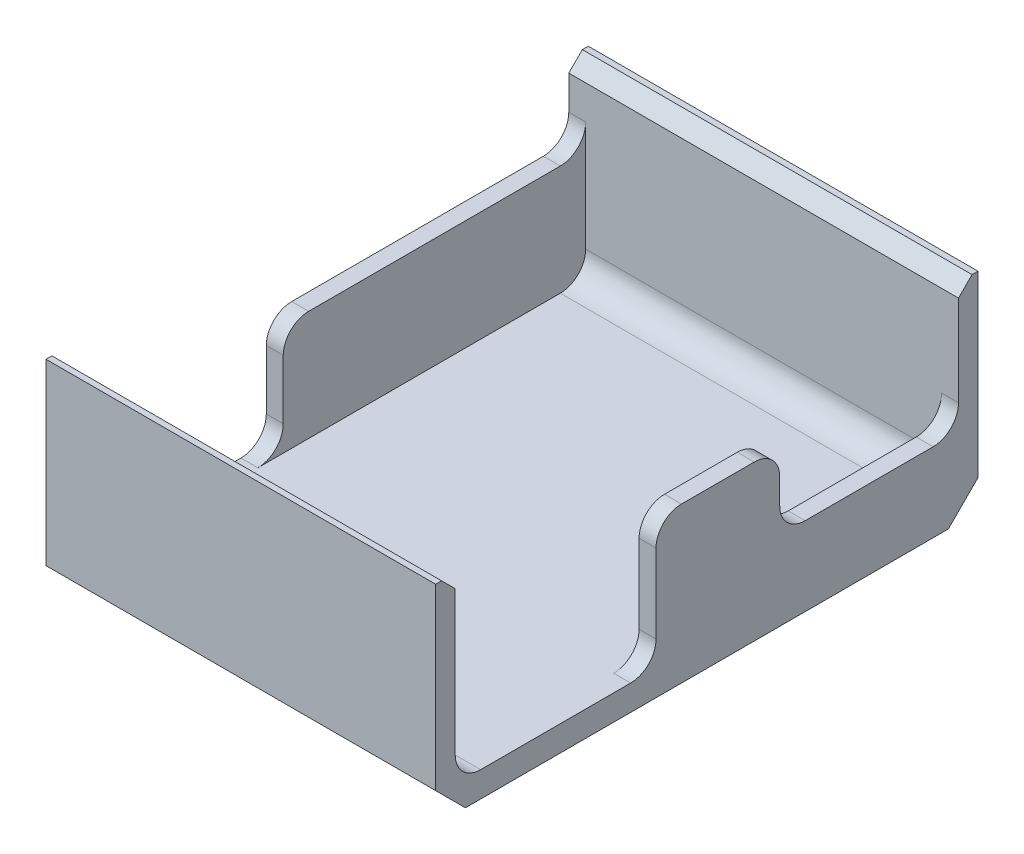
from build123d import *

# Parameters (mm, degrees)
SKETCH1_W           = 46
SKETCH1_H           = 64
BOSS_EXTRUDE1_DEPTH = 3
SKETCH2_W           = 46
SKETCH2_H           = 2.3
BOSS_EXTRUDE2_DEPTH = 22
SKETCH3_W           = 38
SKETCH3_H           = 16
BOSS_EXTRUDE3_DEPTH = 2
BOSS_EXTRUDE4_DEPTH = 2
FILLET1_R           = 3
SKETCH8_W           = 6
SKETCH8_H           = 1.076923077
BOSS_EXTRUDE5_DEPTH = 0.5
CHAMFER1_SIZE       = 2
SKETCH9_W           = 64
SKETCH9_H           = 0.4
CUT_EXTRUDE1_DEPTH  = 83.68615375
CHAMFER2_SIZE       = 3.5


with BuildPart() as part:
    # Sketch1 → Boss-Extrude1 (new body)
    with BuildSketch(Plane(origin=(0, 0, 0), x_dir=(1, 0, 0), z_dir=(0, 1, 0))):
        with Locations((23, 32)):
            Rectangle(SKETCH1_W, SKETCH1_H)
    extrude(amount=BOSS_EXTRUDE1_DEPTH)

    # Sketch2 → Boss-Extrude2 (add)
    with BuildSketch(Plane(origin=(0, 3, 0), x_dir=(1, 0, 0), z_dir=(0, 1, 0))):
        with Locations((23, 62.85)):
            Rectangle(SKETCH2_W, SKETCH2_H)
        with Locations((23, 1.15)):
            Rectangle(SKETCH2_W, SKETCH2_H)
    extrude(amount=BOSS_EXTRUDE2_DEPTH)

    # Sketch3 → Boss-Extrude3 (add)
    with BuildSketch(Plane.ZY):
        with Locations((-45, 8)):
            Rectangle(SKETCH3_W, SKETCH3_H)
    extrude(amount=-BOSS_EXTRUDE3_DEPTH)

    # Sketch5 → Boss-Extrude4 (add)
    with BuildSketch(Plane(origin=(46, 0, 0), x_dir=(0, 0, -1), z_dir=(1, 0, 0))):
        Polygon((64, 0), (26, 0), (26, 9.3), (26, 18.3), (40.6, 18.3), (40.6, 9.3), (64, 9.3), align=None)
    extrude(amount=-BOSS_EXTRUDE4_DEPTH)

    # Fillet1
    fillet1_edges = [part.edges().sort_by_distance(p)[0] for p in [
        (1, 3, -26),
        (1, 16, -26),
        (23, 3, -2.3),
        (1, 16, -61.7),
        (23, 3, -61.7),
        (45, 9.3, -61.7),
        (45, 18.3, -40.6),
        (45, 9.3, -40.6),
        (45, 3, -26),
        (45, 18.3, -26),
    ]]
    fillet(fillet1_edges, radius=FILLET1_R)

    # Sketch8 → Boss-Extrude5 (add)
    # profile 1 of 16: a face of its own
    with BuildSketch(Plane.XZ):
        Polygon((2.042970491, -35.976752262), (2.042970491, -34.977954185), (8.042970491, -32.554877262), (8.042970491, -33.705117646), (6.81220126, -34.1714638), (6.81220126, -36.785646493), (8.042970491, -37.251992646), (8.042970491, -38.401031108), align=None)
        Polygon((3.652345491, -35.477954185), (5.735278183, -36.376992646), (5.735278183, -34.578915723), align=None, mode=Mode.SUBTRACT)
    # profile 2 of 16: a face of its own
    with BuildSketch(Plane.XZ):
        Polygon((2.042970491, -31.670261877), (2.042970491, -30.700309954), (5.991287798, -27.977954185), (2.042970491, -27.977954185), (2.042970491, -26.901031108), (8.042970491, -26.901031108), (8.042970491, -27.878194569), (4.106672414, -30.5933388), (8.042970491, -30.5933388), (8.042970491, -31.670261877), align=None)
    # profile 3 of 16: a face of its own
    with BuildSketch(Plane.XZ):
        Polygon((2.042970491, -26.131800339), (2.042970491, -22.901031108), (3.119893568, -22.901031108), (3.119893568, -23.977954185), (8.042970491, -23.977954185), (8.042970491, -25.054877262), (3.119893568, -25.054877262), (3.119893568, -26.131800339), align=None)
    # profile 4 of 16: a face of its own
    with BuildSketch(Plane.XZ):
        Polygon((2.042970491, -22.054877262), (2.042970491, -18.824108031), (3.119893568, -18.824108031), (3.119893568, -20.977954185), (4.273739722, -20.977954185), (4.273739722, -18.824108031), (5.350662798, -18.824108031), (5.350662798, -20.977954185), (6.966047414, -20.977954185), (6.966047414, -18.824108031), (8.042970491, -18.824108031), (8.042970491, -22.054877262), align=None)
    # profile 5 of 16: a face of its own
    with BuildSketch(Plane.XZ):
        Polygon((2.042970491, -17.747184954), (2.042970491, -16.777233031), (5.991287798, -14.054877262), (2.042970491, -14.054877262), (2.042970491, -12.977954185), (8.042970491, -12.977954185), (8.042970491, -13.955117646), (4.106672414, -16.670261877), (8.042970491, -16.670261877), (8.042970491, -17.747184954), align=None)
    # profile 6 of 16: a face of its own
    with BuildSketch(Plane.XZ):
        Polygon((2.042970491, -9.745983031), (2.042970491, -8.747184954), (8.042970491, -6.324108031), (8.042970491, -7.474348416), (6.81220126, -7.940694569), (6.81220126, -10.554877262), (8.042970491, -11.021223416), (8.042970491, -12.170261877), align=None)
        Polygon((3.652345491, -9.247184954), (5.735278183, -10.146223416), (5.735278183, -8.348146493), align=None, mode=Mode.SUBTRACT)
    # profile 7 of 16: a face of its own
    with BuildSketch(Plane.XZ):
        with BuildLine():
            Line((35.538717626, -21.155652882), (35.538717626, -19.953729805))
            add(Edge.make_bspline(
                [(35.538717626, -19.953729805), (35.539069152, -19.87519771), (35.539747319, -19.723692837), (35.547971017, -19.505210354), (35.562708342, -19.303649538), (35.580921469, -19.119056818), (35.60645515, -18.9515077), (35.635728779, -18.800793641), (35.671388463, -18.666879252), (35.713729131, -18.548267678), (35.763603462, -18.441784791), (35.81687477, -18.341136035), (35.880019658, -18.247836243), (35.948486519, -18.159695001), (36.023699745, -18.077379052), (36.105362078, -18.000278422), (36.194660309, -17.929187031), (36.290979252, -17.864550576), (36.392357922, -17.805883138), (36.499027506, -17.754635867), (36.611143212, -17.713064775), (36.727983451, -17.678192409), (36.849542123, -17.650182421), (36.976567103, -17.631538121), (37.108171377, -17.618873964), (37.197741332, -17.617756527), (37.243044549, -17.617191344)],
                knots=[0, 0, 0, 0, 1.698787518, 3.27731721, 4.728409951, 6.070286353, 7.288646904, 8.393455548, 9.389990496, 10.283725379, 11.113616976, 11.931887102, 12.744353494, 13.547053751, 14.344590688, 15.153907614, 15.974148981, 16.810666655, 17.660988447, 18.506082349, 19.367288142, 20.244738011, 21.142497992, 22.06302001, 23.020302899, 24, 24, 24, 24], degree=3))
            add(Edge.make_bspline(
                [(37.243044549, -17.617191344), (37.293162419, -17.618009094), (37.391650192, -17.619616074), (37.536021189, -17.635369648), (37.673665846, -17.662281743), (37.805745027, -17.697454398), (37.930085439, -17.746500334), (38.049654977, -17.802532427), (38.161097268, -17.871471877), (38.265821346, -17.950238165), (38.364622562, -18.036289743), (38.454856397, -18.131530577), (38.536495899, -18.234838874), (38.613071551, -18.34334561), (38.678451961, -18.461521866), (38.739437735, -18.585230704), (38.791112761, -18.717586483), (38.818235659, -18.809681991), (38.831986857, -18.856374036)],
                knots=[0, 0, 0, 0, 1.101964615, 2.165495883, 3.188506962, 4.184641065, 5.166448333, 6.124117473, 7.085225874, 8.042124548, 9.003636759, 9.963451826, 10.9225791, 11.897800977, 12.880319672, 13.889154746, 14.929810112, 16, 16, 16, 16], degree=3))
            add(Edge.make_bspline(
                [(38.831986857, -18.856374036), (38.83963952, -18.887132129), (38.856217653, -18.953764063), (38.873048619, -19.064021613), (38.888523658, -19.191081862), (38.90182258, -19.33535568), (38.910862748, -19.496926244), (38.917922717, -19.675637112), (38.923056044, -19.871569271), (38.923238197, -20.007812747), (38.923333011, -20.078729805)],
                knots=[0, 0, 0, 0, 0.618981996, 1.340914327, 2.176866532, 3.120127938, 4.170906482, 5.338178032, 6.614476169, 8, 8, 8, 8], degree=3))
            Line((38.923333011, -20.078729805), (41.538717626, -20.078729805))
            Line((41.538717626, -20.078729805), (41.538717626, -21.155652882))
            Line((41.538717626, -21.155652882), (35.538717626, -21.155652882))
        make_face()
        with BuildLine():
            Line((37.846409934, -20.078729805), (37.846409934, -19.69772019))
            add(Edge.make_bspline(
                [(37.846409934, -19.69772019), (37.845970394, -19.628389393), (37.845161635, -19.500819696), (37.833463809, -19.326605683), (37.815602326, -19.186600614), (37.789975784, -19.07600284), (37.751110122, -18.988650186), (37.706071188, -18.91339943), (37.649204485, -18.848318797), (37.583129816, -18.793163489), (37.508697942, -18.748344918), (37.426108294, -18.7168403), (37.336538591, -18.6969735), (37.274002567, -18.6950854), (37.241842626, -18.694114421)],
                knots=[0, 0, 0, 0, 1.862197296, 3.426470689, 4.686743892, 5.65255712, 6.462325617, 7.244961981, 8.000258385, 8.771939908, 9.549006364, 10.32248703, 11.137317743, 12, 12, 12, 12], degree=3))
            add(Edge.make_bspline(
                [(37.241842626, -18.694114421), (37.213737455, -18.695054741), (37.159206665, -18.696879187), (37.080560564, -18.710466784), (37.007389965, -18.731555427), (36.940714846, -18.763785327), (36.87898007, -18.802915362), (36.824107456, -18.852556678), (36.77432169, -18.909803318), (36.748002482, -18.954074501), (36.734631088, -18.976566344)],
                knots=[0, 0, 0, 0, 1.102449765, 2.139017612, 3.12397484, 4.080535277, 5.035673127, 5.982361139, 6.974944601, 8, 8, 8, 8], degree=3))
            add(Edge.make_bspline(
                [(36.734631088, -18.976566344), (36.724998436, -18.995613418), (36.704604138, -19.035939978), (36.680894276, -19.10462002), (36.660892395, -19.183875739), (36.644291027, -19.274242201), (36.631406642, -19.375358908), (36.62155331, -19.48720782), (36.617590901, -19.609953532), (36.616308699, -19.69531583), (36.615640703, -19.739787498)],
                knots=[0, 0, 0, 0, 0.656809284, 1.390599849, 2.23162475, 3.173112763, 4.218524733, 5.370385145, 6.63003504, 8, 8, 8, 8], degree=3))
            Line((36.615640703, -19.739787498), (36.615640703, -20.078729805))
            Line((36.615640703, -20.078729805), (37.846409934, -20.078729805))
        make_face(mode=Mode.SUBTRACT)
    # profile 8 of 16: a face of its own
    with BuildSketch(Plane.XZ):
        with BuildLine():
            Line((36.579583011, -11.078729805), (37.334390703, -11.868393267))
            add(Edge.make_bspline(
                [(37.334390703, -11.868393267), (37.265115387, -11.935372716), (37.129798993, -12.066204565), (36.950850212, -12.277130438), (36.801093936, -12.495925274), (36.677500402, -12.720405815), (36.580221689, -12.951011401), (36.511434961, -13.18851543), (36.469030855, -13.432570867), (36.464216194, -13.59779165), (36.461794549, -13.680893267)],
                knots=[0, 0, 0, 0, 1.115315123, 2.178559852, 3.196385012, 4.180486591, 5.141138664, 6.08807191, 7.038351522, 8, 8, 8, 8], degree=3))
            add(Edge.make_bspline(
                [(36.461794549, -13.680893267), (36.463713389, -13.750290589), (36.467500007, -13.887238559), (36.495326548, -14.088295066), (36.542468305, -14.280688925), (36.607995005, -14.464572776), (36.690515092, -14.640855762), (36.794236892, -14.807896375), (36.915698564, -14.966592308), (37.054687566, -15.115089331), (37.207666931, -15.249150021), (37.368781626, -15.369940607), (37.54088138, -15.469990611), (37.72145645, -15.551661316), (37.910572043, -15.616019709), (38.108218692, -15.661697443), (38.31484265, -15.688163153), (38.455309175, -15.692109017), (38.526698395, -15.694114421)],
                knots=[0, 0, 0, 0, 1.035268443, 2.04298821, 3.02163646, 3.985902049, 4.951223231, 5.920091634, 6.913651787, 7.92868536, 8.949353712, 9.945284791, 10.92850487, 11.913014323, 12.897904816, 13.904240668, 14.934873455, 16, 16, 16, 16], degree=3))
            add(Edge.make_bspline(
                [(38.526698395, -15.694114421), (38.576802621, -15.693527499), (38.675559079, -15.692370663), (38.82127633, -15.680052614), (38.962945327, -15.659538967), (39.100225583, -15.630963316), (39.23329635, -15.5943317), (39.362469228, -15.55201587), (39.48620409, -15.497967753), (39.60681771, -15.438515537), (39.721406672, -15.370117629), (39.830046417, -15.29522171), (39.932761263, -15.214518021), (40.029185993, -15.126928754), (40.117932505, -15.031350969), (40.201417247, -14.930093017), (40.278323333, -14.822148977), (40.347426089, -14.707475587), (40.411837183, -14.589542988), (40.465175766, -14.465921628), (40.513124574, -14.340069427), (40.549196364, -14.209777582), (40.580571238, -14.077341427), (40.599732841, -13.940917505), (40.614293128, -13.801800549), (40.615189578, -13.707776698), (40.615640703, -13.660460575)],
                knots=[0, 0, 0, 0, 1.103738238, 2.175490744, 3.219137561, 4.256155604, 5.262629953, 6.259184223, 7.247888397, 8.234817694, 9.220364322, 10.185094651, 11.140491148, 12.096499151, 13.05201798, 14.011605636, 14.986460005, 15.968997565, 16.960259839, 17.944382265, 18.933125845, 19.924977513, 20.920749559, 21.929466621, 22.958034467, 24, 24, 24, 24], degree=3))
            add(Edge.make_bspline(
                [(40.615640703, -13.660460575), (40.613328044, -13.580201666), (40.608784272, -13.422513782), (40.572993176, -13.19113933), (40.514745532, -12.970307075), (40.443974087, -12.794500589), (40.375351135, -12.656682007), (40.313662166, -12.550882821), (40.242544609, -12.442638901), (40.161703152, -12.332115093), (40.071491035, -12.218669898), (39.970145543, -12.10418068), (39.860942457, -11.985753181), (39.783004687, -11.908171058), (39.743044549, -11.868393267)],
                knots=[0, 0, 0, 0, 1.404693586, 2.759857621, 4.088769373, 5.395275838, 6.0697462, 6.783214465, 7.53810233, 8.336454657, 9.18000028, 10.074808326, 11.012918585, 12, 12, 12, 12], degree=3))
            Line((39.743044549, -11.868393267), (40.547131088, -11.102768267))
            add(Edge.make_bspline(
                [(40.547131088, -11.102768267), (40.599091948, -11.156587583), (40.700508435, -11.261631379), (40.844510384, -11.42008703), (40.973912143, -11.578343257), (41.093410428, -11.732576922), (41.199523966, -11.88531453), (41.292358732, -12.036539887), (41.374262652, -12.184541053), (41.443854457, -12.332391321), (41.502945127, -12.481010691), (41.553818315, -12.633922558), (41.596855202, -12.791594388), (41.631580318, -12.954989168), (41.659425173, -13.12258285), (41.678220289, -13.295943891), (41.690855621, -13.473973094), (41.69199101, -13.59473306), (41.69256378, -13.655652882)],
                knots=[0, 0, 0, 0, 1.244526981, 2.429050516, 3.560637417, 4.644440555, 5.67424972, 6.652764056, 7.595344123, 8.486817594, 9.369275933, 10.254498637, 11.166417451, 12.086725134, 13.032340136, 13.991389299, 14.986715468, 16, 16, 16, 16], degree=3))
            add(Edge.make_bspline(
                [(41.69256378, -13.655652882), (41.689711171, -13.767555049), (41.684129407, -13.986516484), (41.642772317, -14.307398759), (41.573437885, -14.612228306), (41.475379875, -14.901746719), (41.350115361, -15.175861937), (41.19654695, -15.434503835), (41.015082648, -15.677255538), (40.807849393, -15.902156091), (40.578977659, -16.105589344), (40.333232206, -16.285400781), (40.069405285, -16.434140809), (39.791394461, -16.557642859), (39.497931064, -16.654219838), (39.188697656, -16.722193658), (38.863992821, -16.764112617), (38.642211933, -16.768698611), (38.529102241, -16.771037498)],
                knots=[0, 0, 0, 0, 1.078019885, 2.10938526, 3.111377082, 4.085535484, 5.04941344, 6.010039228, 6.978205633, 7.964457913, 8.951525778, 9.924444315, 10.892603023, 11.863865945, 12.85144698, 13.863884204, 14.910567087, 16, 16, 16, 16], degree=3))
            add(Edge.make_bspline(
                [(38.529102241, -16.771037498), (38.455331295, -16.770058939), (38.309135308, -16.768119676), (38.09341263, -16.747355692), (37.883385104, -16.719152706), (37.680847491, -16.672823588), (37.48349438, -16.618963939), (37.293072232, -16.549573771), (37.108778916, -16.46895614), (36.930847194, -16.376905772), (36.761198492, -16.27147592), (36.598750902, -16.156690833), (36.445608761, -16.029766671), (36.301140683, -15.89198807), (36.163710318, -15.744628216), (36.036697535, -15.58516338), (35.916694882, -15.416313173), (35.807281305, -15.236907941), (35.70777154, -15.051035785), (35.622160637, -14.859599879), (35.548703347, -14.665068132), (35.488225689, -14.466850696), (35.442960115, -14.264597079), (35.408728849, -14.059662509), (35.389586124, -13.850326965), (35.386453035, -13.709775431), (35.384871472, -13.638825959)],
                knots=[0, 0, 0, 0, 1.071814294, 2.12407397, 3.147667899, 4.14936388, 5.141177959, 6.119239245, 7.091825145, 8.063277363, 9.028022524, 9.992609517, 10.952139039, 11.915934802, 12.892469547, 13.878248468, 14.87668965, 15.901326483, 16.93027266, 17.938917451, 18.9468897, 19.950817235, 20.948103127, 21.957084021, 22.968749718, 24, 24, 24, 24], degree=3))
            add(Edge.make_bspline(
                [(35.384871472, -13.638825959), (35.385779003, -13.578299126), (35.387584629, -13.457874769), (35.402609883, -13.278537751), (35.42627389, -13.100654619), (35.461728344, -12.924768571), (35.50466532, -12.750088658), (35.557552083, -12.577346218), (35.622061539, -12.407017594), (35.69342261, -12.237626171), (35.774663485, -12.072550209), (35.865596725, -11.91322433), (35.963843431, -11.759253753), (36.07109346, -11.611566663), (36.18577145, -11.469122839), (36.307873603, -11.332074264), (36.439614824, -11.201736024), (36.532691083, -11.119939161), (36.579583011, -11.078729805)],
                knots=[0, 0, 0, 0, 0.996333415, 1.982307736, 2.96084097, 3.949129141, 4.93457382, 5.921430247, 6.92116383, 7.931890485, 8.946633814, 9.948019707, 10.950686436, 11.952094051, 12.951305284, 13.960287133, 14.972390273, 16, 16, 16, 16], degree=3))
        make_face()
    # profile 9 of 16: a face of its own
    with BuildSketch(Plane.XZ):
        with Locations((38.538717626, -58.039332271)):
            Rectangle(SKETCH8_W, SKETCH8_H)
    # profile 10 of 16: a face of its own
    with BuildSketch(Plane.XZ):
        Polygon((35.538717626, -56.116255347), (35.538717626, -55.146303424), (39.487034934, -52.423947655), (35.538717626, -52.423947655), (35.538717626, -51.347024578), (41.538717626, -51.347024578), (41.538717626, -52.324188039), (37.602419549, -55.03933227), (41.538717626, -55.03933227), (41.538717626, -56.116255347), align=None)
    # profile 11 of 16: a face of its own
    with BuildSketch(Plane.XZ):
        with BuildLine():
            Line((35.538717626, -49.962409193), (35.538717626, -48.760486116))
            add(Edge.make_bspline(
                [(35.538717626, -48.760486116), (35.539069152, -48.681954021), (35.539747319, -48.530449148), (35.547971017, -48.311966665), (35.562708342, -48.110405849), (35.580921469, -47.925813129), (35.60645515, -47.758264011), (35.635728779, -47.607549952), (35.671388463, -47.473635563), (35.713729131, -47.355023989), (35.763603462, -47.248541102), (35.81687477, -47.147892346), (35.880019658, -47.054592554), (35.948486519, -46.966451312), (36.023699745, -46.884135363), (36.105362078, -46.807034733), (36.194660309, -46.735943342), (36.290979252, -46.671306887), (36.392357922, -46.612639449), (36.499027506, -46.561392178), (36.611143212, -46.519821086), (36.727983451, -46.48494872), (36.849542123, -46.456938732), (36.976567103, -46.438294432), (37.108171377, -46.425630275), (37.197741332, -46.424512838), (37.243044549, -46.423947655)],
                knots=[0, 0, 0, 0, 1.698787518, 3.27731721, 4.728409951, 6.070286353, 7.288646904, 8.393455548, 9.389990496, 10.283725379, 11.113616976, 11.931887102, 12.744353494, 13.547053751, 14.344590688, 15.153907614, 15.974148981, 16.810666655, 17.660988447, 18.506082349, 19.367288142, 20.244738011, 21.142497992, 22.06302001, 23.020302899, 24, 24, 24, 24], degree=3))
            add(Edge.make_bspline(
                [(37.243044549, -46.423947655), (37.293162419, -46.424765405), (37.391650192, -46.426372385), (37.536021189, -46.442125959), (37.673665846, -46.469038054), (37.805745027, -46.504210709), (37.930085439, -46.553256645), (38.049654977, -46.609288738), (38.161097268, -46.678228188), (38.265821346, -46.756994476), (38.364622562, -46.843046054), (38.454856397, -46.938286888), (38.536495899, -47.041595185), (38.613071551, -47.150101921), (38.678451961, -47.268278177), (38.739437735, -47.391987015), (38.791112761, -47.524342794), (38.818235659, -47.616438302), (38.831986857, -47.663130347)],
                knots=[0, 0, 0, 0, 1.101964615, 2.165495883, 3.188506962, 4.184641065, 5.166448333, 6.124117473, 7.085225874, 8.042124548, 9.003636759, 9.963451826, 10.9225791, 11.897800977, 12.880319672, 13.889154746, 14.929810112, 16, 16, 16, 16], degree=3))
            add(Edge.make_bspline(
                [(38.831986857, -47.663130347), (38.83963952, -47.69388844), (38.856217653, -47.760520374), (38.873048619, -47.870777924), (38.888523658, -47.997838173), (38.90182258, -48.142111991), (38.910862748, -48.303682555), (38.917922717, -48.482393423), (38.923056044, -48.678325582), (38.923238197, -48.814569058), (38.923333011, -48.885486116)],
                knots=[0, 0, 0, 0, 0.618981996, 1.340914327, 2.176866532, 3.120127938, 4.170906482, 5.338178032, 6.614476169, 8, 8, 8, 8], degree=3))
            Line((38.923333011, -48.885486116), (41.538717626, -48.885486116))
            Line((41.538717626, -48.885486116), (41.538717626, -49.962409193))
            Line((41.538717626, -49.962409193), (35.538717626, -49.962409193))
        make_face()
        with BuildLine():
            Line((37.846409934, -48.885486116), (37.846409934, -48.504476501))
            add(Edge.make_bspline(
                [(37.846409934, -48.504476501), (37.845970394, -48.435145704), (37.845161635, -48.307576007), (37.833463809, -48.133361994), (37.815602326, -47.993356925), (37.789975784, -47.882759151), (37.751110122, -47.795406497), (37.706071188, -47.720155741), (37.649204485, -47.655075108), (37.583129816, -47.5999198), (37.508697942, -47.555101229), (37.426108294, -47.523596611), (37.336538591, -47.503729811), (37.274002567, -47.501841711), (37.241842626, -47.500870732)],
                knots=[0, 0, 0, 0, 1.862197296, 3.426470689, 4.686743892, 5.65255712, 6.462325617, 7.244961981, 8.000258385, 8.771939908, 9.549006364, 10.32248703, 11.137317743, 12, 12, 12, 12], degree=3))
            add(Edge.make_bspline(
                [(37.241842626, -47.500870732), (37.213737455, -47.501811052), (37.159206665, -47.503635498), (37.080560564, -47.517223095), (37.007389965, -47.538311738), (36.940714846, -47.570541638), (36.87898007, -47.609671673), (36.824107456, -47.659312989), (36.77432169, -47.716559629), (36.748002482, -47.760830812), (36.734631088, -47.783322655)],
                knots=[0, 0, 0, 0, 1.102449765, 2.139017612, 3.12397484, 4.080535277, 5.035673127, 5.982361139, 6.974944601, 8, 8, 8, 8], degree=3))
            add(Edge.make_bspline(
                [(36.734631088, -47.783322655), (36.724998436, -47.802369729), (36.704604138, -47.842696289), (36.680894276, -47.911376331), (36.660892395, -47.99063205), (36.644291027, -48.080998512), (36.631406642, -48.182115219), (36.62155331, -48.293964131), (36.617590901, -48.416709843), (36.616308699, -48.502072141), (36.615640703, -48.546543809)],
                knots=[0, 0, 0, 0, 0.656809284, 1.390599849, 2.23162475, 3.173112763, 4.218524733, 5.370385145, 6.63003504, 8, 8, 8, 8], degree=3))
            Line((36.615640703, -48.546543809), (36.615640703, -48.885486116))
            Line((36.615640703, -48.885486116), (37.846409934, -48.885486116))
        make_face(mode=Mode.SUBTRACT)
    # profile 12 of 16: a face of its own
    with BuildSketch(Plane.XZ):
        with BuildLine():
            Line((35.538717626, -45.270101501), (35.538717626, -44.193178424))
            Line((35.538717626, -44.193178424), (39.44256378, -44.193178424))
            add(Edge.make_bspline(
                [(39.44256378, -44.193178424), (39.483036884, -44.193117485), (39.561210267, -44.192999782), (39.673367967, -44.187369427), (39.776846682, -44.182062889), (39.870807635, -44.173033983), (39.955542499, -44.158871507), (40.031363462, -44.145648843), (40.097594822, -44.127520326), (40.173035038, -44.100372788), (40.257784033, -44.057989347), (40.347112953, -43.990765465), (40.426623232, -43.910488765), (40.493383772, -43.81595068), (40.549850605, -43.710402194), (40.587198686, -43.591763243), (40.612531218, -43.463890605), (40.614584823, -43.374801644), (40.615640703, -43.328995732)],
                knots=[0, 0, 0, 0, 1.155195489, 2.231248153, 3.20507519, 4.113220553, 4.92363642, 5.657123012, 6.309133385, 6.880755525, 7.944644177, 8.999147208, 10.058600405, 11.156792429, 12.29246015, 13.460660758, 14.694375292, 16, 16, 16, 16], degree=3))
            add(Edge.make_bspline(
                [(40.615640703, -43.328995732), (40.614222218, -43.280385382), (40.611456412, -43.185603429), (40.584307033, -43.049274678), (40.541075922, -42.922965321), (40.479374112, -42.80934974), (40.405413673, -42.708541061), (40.321075615, -42.623208475), (40.226191641, -42.555864837), (40.138654159, -42.511971116), (40.058083006, -42.487330856), (39.986097551, -42.468847019), (39.901546235, -42.455425436), (39.805016309, -42.44286007), (39.695804452, -42.435736269), (39.574481551, -42.427623353), (39.44097379, -42.424713993), (39.348011763, -42.42421031), (39.299534934, -42.423947655)],
                knots=[0, 0, 0, 0, 1.26131785, 2.459356261, 3.594833267, 4.716926138, 5.803419038, 6.833631221, 7.818372604, 8.814377287, 9.360705024, 10.004324776, 10.743421339, 11.582437492, 12.532246195, 13.585177397, 14.740744533, 16, 16, 16, 16], degree=3))
            Line((39.299534934, -42.423947655), (35.538717626, -42.423947655))
            Line((35.538717626, -42.423947655), (35.538717626, -41.347024578))
            Line((35.538717626, -41.347024578), (39.118044549, -41.347024578))
            add(Edge.make_bspline(
                [(39.118044549, -41.347024578), (39.190561542, -41.347174128), (39.330004646, -41.347461699), (39.530394199, -41.351877918), (39.713417912, -41.361279251), (39.879129264, -41.369175285), (40.027305013, -41.384456817), (40.158577919, -41.400376584), (40.272482753, -41.420667712), (40.402149649, -41.450859631), (40.551455793, -41.502962324), (40.723377859, -41.586956899), (40.89169017, -41.693589416), (41.054589865, -41.819597122), (41.205772779, -41.961971445), (41.338869286, -42.116936747), (41.449614636, -42.283782158), (41.539157327, -42.461737009), (41.608104657, -42.65267916), (41.656838387, -42.857058951), (41.687849009, -43.076045159), (41.690960688, -43.227123738), (41.69256378, -43.30495727)],
                knots=[0, 0, 0, 0, 1.170930413, 2.251584989, 3.235934929, 4.130173708, 4.929654547, 5.640582214, 6.264911921, 6.796838084, 7.789064304, 8.810388137, 9.880124863, 11.000704429, 12.131026409, 13.227749078, 14.29171941, 15.356377855, 16.43689688, 17.561893293, 18.743922147, 20, 20, 20, 20], degree=3))
            add(Edge.make_bspline(
                [(41.69256378, -43.30495727), (41.691690109, -43.356677394), (41.689966373, -43.458720138), (41.674846904, -43.608804868), (41.65238326, -43.753841578), (41.620246634, -43.893907205), (41.576377898, -44.028518776), (41.524535747, -44.158547534), (41.465218486, -44.284464498), (41.393230213, -44.402334592), (41.317614812, -44.515053482), (41.234879881, -44.618839653), (41.148694344, -44.715288871), (41.057085473, -44.803280862), (40.960705848, -44.882897869), (40.859461127, -44.954078019), (40.75332771, -45.016688415), (40.640401402, -45.072312573), (40.514939368, -45.119916459), (40.372483216, -45.160068448), (40.211171065, -45.194973458), (40.029940225, -45.221396687), (39.829615867, -45.244685475), (39.609433505, -45.259775653), (39.370105588, -45.267564799), (39.204187937, -45.269234568), (39.118044549, -45.270101501)],
                knots=[0, 0, 0, 0, 1.001237316, 1.975420686, 2.917953599, 3.841913885, 4.754568974, 5.656377887, 6.55158913, 7.445656762, 8.327865759, 9.178398172, 10.013362476, 10.830881591, 11.635451955, 12.431789376, 13.224756564, 14.019278107, 14.866442763, 15.819105778, 16.882716987, 18.059987251, 19.363897986, 20.787153213, 22.331910422, 24, 24, 24, 24], degree=3))
            Line((39.118044549, -45.270101501), (35.538717626, -45.270101501))
        make_face()
    # profile 13 of 16: a face of its own
    with BuildSketch(Plane.XZ):
        Polygon((35.538717626, -40.577793809), (35.538717626, -37.347024578), (36.615640703, -37.347024578), (36.615640703, -38.423947655), (41.538717626, -38.423947655), (41.538717626, -39.500870732), (36.615640703, -39.500870732), (36.615640703, -40.577793809), align=None)
    # profile 14 of 16: a face of its own
    with BuildSketch(Plane.XZ):
        with BuildLine():
            Line((4.042970491, -57.731639963), (4.042970491, -58.808563039))
            add(Edge.make_bspline(
                [(4.042970491, -58.808563039), (3.961506105, -58.8039138), (3.802329586, -58.794829465), (3.571134892, -58.758654642), (3.352627877, -58.710306174), (3.147465458, -58.64522794), (2.955561442, -58.565069496), (2.7775515, -58.467835791), (2.612160106, -58.356429877), (2.462287896, -58.228606156), (2.327548221, -58.089552377), (2.209755261, -57.939625026), (2.111147149, -57.77924999), (2.030258464, -57.609499662), (1.965537098, -57.431040801), (1.922288408, -57.242070334), (1.892993635, -57.044255676), (1.890430639, -56.908834323), (1.889124337, -56.839813039)],
                knots=[0, 0, 0, 0, 1.198928049, 2.342633425, 3.435730849, 4.486331048, 5.502589352, 6.488331875, 7.46361919, 8.428949135, 9.378681775, 10.305958057, 11.226249248, 12.140413166, 13.066341608, 14.010670971, 14.986082777, 16, 16, 16, 16], degree=3))
            add(Edge.make_bspline(
                [(1.889124337, -56.839813039), (1.891590197, -56.755052347), (1.896406248, -56.589506906), (1.94291791, -56.349755809), (2.0141429, -56.124643231), (2.117622986, -55.91656373), (2.248112209, -55.72587908), (2.404002135, -55.553649423), (2.58718656, -55.403233785), (2.792390239, -55.275805236), (3.010106029, -55.17042854), (3.234822028, -55.095876236), (3.460738418, -55.047132006), (3.612841073, -55.041921008), (3.688403183, -55.03933227)],
                knots=[0, 0, 0, 0, 1.075374184, 2.100304875, 3.089917907, 4.066149699, 5.039978333, 6.01615708, 7.006437042, 8.039858286, 9.077679641, 10.07047942, 11.041445745, 12, 12, 12, 12], degree=3))
            add(Edge.make_bspline(
                [(3.688403183, -55.03933227), (3.734109369, -55.040338896), (3.826104632, -55.042364984), (3.965316044, -55.056452641), (4.10711914, -55.077586917), (4.251392354, -55.10945223), (4.398176055, -55.14919098), (4.547909811, -55.197399468), (4.699743525, -55.255197645), (4.855390637, -55.3216143), (5.015338121, -55.400871903), (5.182059353, -55.493064388), (5.355376846, -55.601273961), (5.536990602, -55.721978073), (5.724127587, -55.859925255), (5.918865809, -56.011461416), (6.120898416, -56.177349351), (6.256007055, -56.294994814), (6.325422414, -56.355438039)],
                knots=[0, 0, 0, 0, 0.728277616, 1.465842947, 2.227925269, 3.011838508, 3.818735656, 4.650581052, 5.517389122, 6.406849312, 7.346234817, 8.360743166, 9.441530624, 10.601362564, 11.834937575, 13.145232671, 14.533293658, 16, 16, 16, 16], degree=3))
            Line((6.325422414, -56.355438039), (7.042970491, -56.981639963))
            Line((7.042970491, -56.981639963), (7.042970491, -54.962409193))
            Line((7.042970491, -54.962409193), (8.042970491, -54.962409193))
            Line((8.042970491, -54.962409193), (8.042970491, -58.962409193))
            Line((8.042970491, -58.962409193), (7.497297414, -58.962409193))
            Line((7.497297414, -58.962409193), (5.606672414, -57.185966886))
            add(Edge.make_bspline(
                [(5.606672414, -57.185966886), (5.551522844, -57.134533501), (5.444714483, -57.034922289), (5.287846079, -56.893199026), (5.139013841, -56.764904794), (4.996491807, -56.652908234), (4.865105587, -56.550433234), (4.739888281, -56.464705359), (4.624366228, -56.390046883), (4.483549441, -56.312058218), (4.316868839, -56.236290167), (4.124964632, -56.166812072), (3.94141979, -56.124884899), (3.821603902, -56.119053066), (3.764124337, -56.116255347)],
                knots=[0, 0, 0, 0, 1.246192343, 2.413505005, 3.49357156, 4.492416076, 5.408771964, 6.246246772, 6.999304986, 7.680960093, 8.904522682, 10.020616941, 11.0504258, 12, 12, 12, 12], degree=3))
            add(Edge.make_bspline(
                [(3.764124337, -56.116255347), (3.708515306, -56.118341614), (3.600763892, -56.122384091), (3.447488081, -56.166807634), (3.30871248, -56.235630127), (3.188583861, -56.33261074), (3.08986621, -56.450084636), (3.016442794, -56.585836757), (2.97407782, -56.738760326), (2.968775238, -56.84596266), (2.966047414, -56.901111116)],
                knots=[0, 0, 0, 0, 1.062038974, 2.057870785, 3.028805853, 4.01125022, 4.991535629, 5.949134679, 6.94496649, 8, 8, 8, 8], degree=3))
            add(Edge.make_bspline(
                [(2.966047414, -56.901111116), (2.967055105, -56.929601511), (2.969038907, -56.985689429), (2.982244538, -57.068134283), (3.005518085, -57.146586486), (3.036701362, -57.221919253), (3.07803502, -57.293328613), (3.128985339, -57.36063445), (3.188257555, -57.424545915), (3.255666332, -57.484769884), (3.330894547, -57.539581558), (3.413255144, -57.588265087), (3.502697, -57.628518261), (3.598039344, -57.663958618), (3.700306233, -57.691291917), (3.808885609, -57.71119395), (3.923600829, -57.726324136), (4.002456755, -57.729835786), (4.042970491, -57.731639963)],
                knots=[0, 0, 0, 0, 0.903469896, 1.778625579, 2.63899355, 3.493148037, 4.358286772, 5.247621495, 6.164656832, 7.118446693, 8.109501108, 9.111810964, 10.146451449, 11.215617525, 12.33435995, 13.498009769, 14.714554818, 16, 16, 16, 16], degree=3))
        make_face()
    # profile 15 of 16: a face of its own
    with BuildSketch(Plane.XZ):
        Polygon((1.889124337, -51.777313039), (1.889124337, -50.654716886), (5.81220126, -50.654716886), (5.81220126, -50.116255347), (6.81220126, -50.116255347), (6.81220126, -50.654716886), (8.042970491, -50.654716886), (8.042970491, -51.731639963), (6.81220126, -51.731639963), (6.81220126, -54.270101501), (5.722057029, -54.270101501), align=None)
        Polygon((5.81220126, -51.731639963), (3.770133952, -51.731639963), (5.81220126, -53.059764963), align=None, mode=Mode.SUBTRACT)
    # profile 16 of 16: a face of its own
    with BuildSketch(Plane.XZ):
        Polygon((2.042970491, -49.53933227), (2.042970491, -48.389091886), (6.304989722, -46.847024578), (2.042970491, -45.301351501), (2.042970491, -44.154716886), (8.042970491, -46.330197655), (8.042970491, -47.36745727), align=None)
    extrude(amount=BOSS_EXTRUDE5_DEPTH)

    # Chamfer1
    chamfer1_edges = [part.edges().sort_by_distance(p)[0] for p in [
        (23, 25, -61.7),
        (23, 25, -2.3),
    ]]
    chamfer(chamfer1_edges, length=CHAMFER1_SIZE)

    # Sketch9 → Cut-Extrude1 (cut, through all)
    with BuildSketch(Plane.ZY):
        with Locations((-32, 24.8)):
            Rectangle(SKETCH9_W, SKETCH9_H)
    extrude(amount=-CUT_EXTRUDE1_DEPTH, mode=Mode.SUBTRACT)

    # Chamfer2
    chamfer2_edges = [part.edges().sort_by_distance(p)[0] for p in [
        (23, 0, 0),
        (23, 0, -64),
    ]]
    chamfer(chamfer2_edges, length=CHAMFER2_SIZE)


solid = part.part
